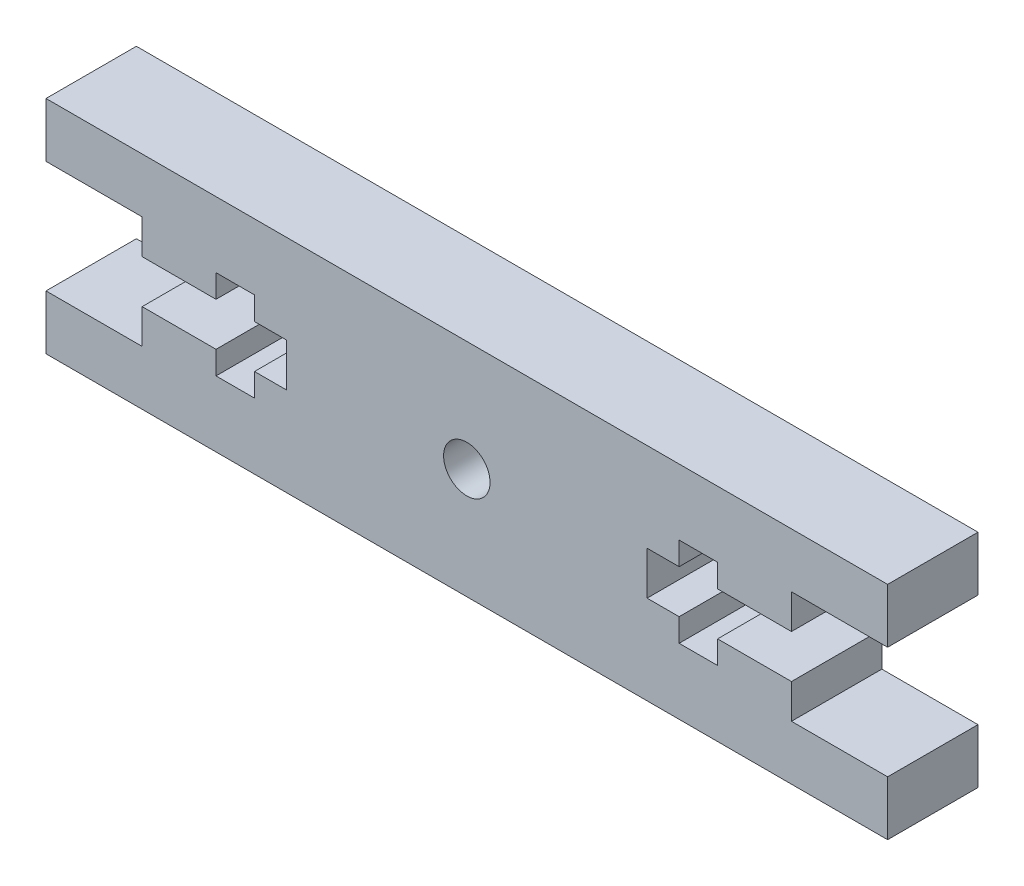
from build123d import *

# Parameters (mm, degrees)
SKETCH1_R           = 1.45
BOSS_EXTRUDE2_DEPTH = 5.64


with BuildPart() as part:
    # Sketch1 → Boss-Extrude2 (new body)
    with BuildSketch(Plane.XY):
        Polygon((727.32944815, 349.198465228), (779.84944815, 349.198465228), (779.84944815, 345.798465228), (773.84944815, 345.798465228), (773.84944815, 343.648465228), (769.23944815, 343.648465228), (769.23944815, 345.088465228), (766.83944815, 345.088465228), (766.83944815, 343.648465228), (764.83944815, 343.648465228), (764.83944815, 340.948465228), (766.83944815, 340.948465228), (766.83944815, 339.508465228), (769.23944815, 339.508465228), (769.23944815, 340.948465228), (773.84944815, 340.948465228), (773.84944815, 338.798465228), (779.84944815, 338.798465228), (779.84944815, 335.398465228), (727.32944815, 335.398465228), (727.32944815, 338.798465228), (733.32944815, 338.798465228), (733.32944815, 340.948465228), (737.93944815, 340.948465228), (737.93944815, 339.508465228), (740.33944815, 339.508465228), (740.33944815, 340.948465228), (742.33944815, 340.948465228), (742.33944815, 343.648465228), (740.33944815, 343.648465228), (740.33944815, 345.088465228), (737.93944815, 345.088465228), (737.93944815, 343.648465228), (733.32944815, 343.648465228), (733.32944815, 345.798465228), (727.32944815, 345.798465228), align=None)
        with Locations((753.58944815, 342.298465228)):
            Circle(SKETCH1_R, mode=Mode.SUBTRACT)
    extrude(amount=BOSS_EXTRUDE2_DEPTH)


solid = part.part
